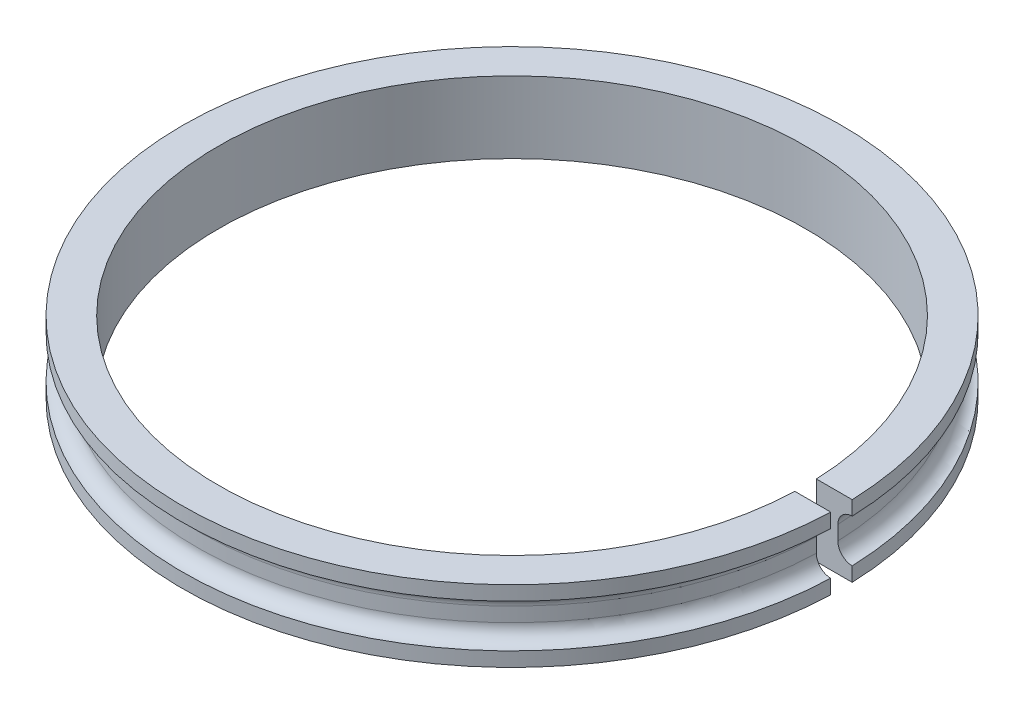
from build123d import *

# Parameters (mm, degrees)
SKETCH1_R           = 46
SKETCH1_R_2         = 41
BOSS_EXTRUDE1_DEPTH = 10
SKETCH2_W           = 13.706072516
SKETCH2_H           = 3
CUT_EXTRUDE2_DEPTH  = 147.754897704
SKETCH3_R           = 47
SKETCH3_R_2         = 44
CUT_EXTRUDE3_DEPTH  = 6
FILLET1_R           = 2
FILLET2_R           = 2


with BuildPart() as part:
    # Sketch1 → Boss-Extrude1 (new body)
    with BuildSketch(Plane(origin=(0, 0, 0), x_dir=(1, 0, 0), z_dir=(0, 1, 0))):
        with Locations(Location((-93, 0, 0), (0, 0, 270))):
            Circle(SKETCH1_R)
        with Locations(Location((-93, 0, 0), (0, 0, 270))):
            Circle(SKETCH1_R_2, mode=Mode.SUBTRACT)
    extrude(amount=BOSS_EXTRUDE1_DEPTH)

    # Sketch2 → Cut-Extrude2 (cut, through all)
    with BuildSketch(Plane(origin=(0, 0, 0), x_dir=(1, 0, 0), z_dir=(0, 1, 0))):
        with Locations((-51, 0)):
            Rectangle(SKETCH2_W, SKETCH2_H)
    extrude(amount=CUT_EXTRUDE2_DEPTH, mode=Mode.SUBTRACT)

    # Sketch3 → Cut-Extrude3 (cut)
    with BuildSketch(Plane(origin=(0, 2, 0), x_dir=(-1, 0, 0), z_dir=(0, -1, 0))):
        with Locations((93, 0)):
            Circle(SKETCH3_R)
        with Locations((93, 0)):
            Circle(SKETCH3_R_2, mode=Mode.SUBTRACT)
    extrude(amount=-CUT_EXTRUDE3_DEPTH, mode=Mode.SUBTRACT)

    # Fillet1
    fillet1_edges = [part.edges().sort_by_distance(p)[0] for p in [
        (-93.750109011, 8, 43.993605632),
    ]]
    fillet(fillet1_edges, radius=FILLET1_R - 0.0001)  # a hair under: the kernel refuses the full size

    # Fillet2
    fillet2_edges = [part.edges().sort_by_distance(p)[0] for p in [
        (-93.750109011, 2, 43.993605632),
    ]]
    fillet(fillet2_edges, radius=FILLET2_R - 0.0001)  # a hair under: the kernel refuses the full size


solid = part.part
